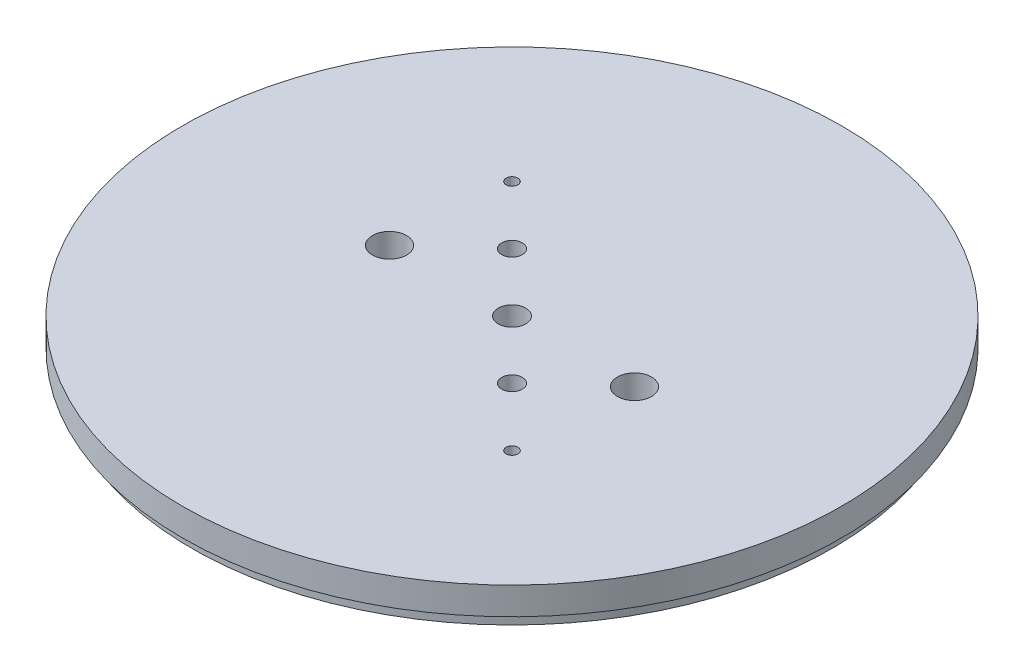
from build123d import *

# Parameters (mm, degrees)
SKETCH1_R           = 76.2
SKETCH1_R_2         = 3.175
SKETCH1_R_3         = 3.937
SKETCH1_R_4         = 1.3589
SKETCH1_R_5         = 2.38125
BOSS_EXTRUDE1_DEPTH = 9.525
SKETCH2_R           = 76.2
SKETCH2_R_2         = 74.041
CUT_EXTRUDE1_DEPTH  = 3.175
CUT_EXTRUDE2_START  = -5.969
CUT_EXTRUDE2_DEPTH  = 3.556


with BuildPart() as part:
    # Sketch1 → Boss-Extrude1 (new body)
    with BuildSketch(Plane(origin=(0, 0, 0), x_dir=(1, 0, 0), z_dir=(0, 1, 0))):
        Circle(SKETCH1_R)
        Circle(SKETCH1_R_2, mode=Mode.SUBTRACT)
        with Locations((28.321, 0)):
            Circle(SKETCH1_R_3, mode=Mode.SUBTRACT)
        with Locations((-28.321, 0)):
            Circle(SKETCH1_R_3, mode=Mode.SUBTRACT)
        with Locations((-26.940768363, 26.940768363)):
            Circle(SKETCH1_R_4, mode=Mode.SUBTRACT)
        with Locations((26.940768363, -26.940768363)):
            Circle(SKETCH1_R_4, mode=Mode.SUBTRACT)
        with Locations((-13.470384182, 13.470384182)):
            Circle(SKETCH1_R_5, mode=Mode.SUBTRACT)
        with Locations((13.470384182, -13.470384182)):
            Circle(SKETCH1_R_5, mode=Mode.SUBTRACT)
    extrude(amount=BOSS_EXTRUDE1_DEPTH)

    # Sketch2 → Cut-Extrude1 (cut)
    with BuildSketch(Plane.XZ):
        Circle(SKETCH2_R)
        Circle(SKETCH2_R_2, mode=Mode.SUBTRACT)
    extrude(amount=-CUT_EXTRUDE1_DEPTH, mode=Mode.SUBTRACT)

    # Sketch3 → Cut-Extrude2 (cut)
    with BuildSketch(Plane(origin=(0, 9.525, 0), x_dir=(1, 0, 0), z_dir=(0, 1, 0)).offset(CUT_EXTRUDE2_START)):
        with BuildLine():
            Line((3.2385, 34.798), (3.2385, 13.97))
            ThreePointArc((3.2385, 13.97), (0, 10.7315), (-3.2385, 13.97))
            Line((-3.2385, 13.97), (-3.2385, 34.798))
            ThreePointArc((-3.2385, 34.798), (0, 38.0365), (3.2385, 34.798))
        make_face()
        with BuildLine():
            Line((3.2385, -34.798), (3.2385, -13.97))
            ThreePointArc((3.2385, -13.97), (0, -10.7315), (-3.2385, -13.97))
            Line((-3.2385, -13.97), (-3.2385, -34.798))
            ThreePointArc((-3.2385, -34.798), (0, -38.0365), (3.2385, -34.798))
        make_face()
    extrude(amount=-CUT_EXTRUDE2_DEPTH, mode=Mode.SUBTRACT)


solid = part.part
